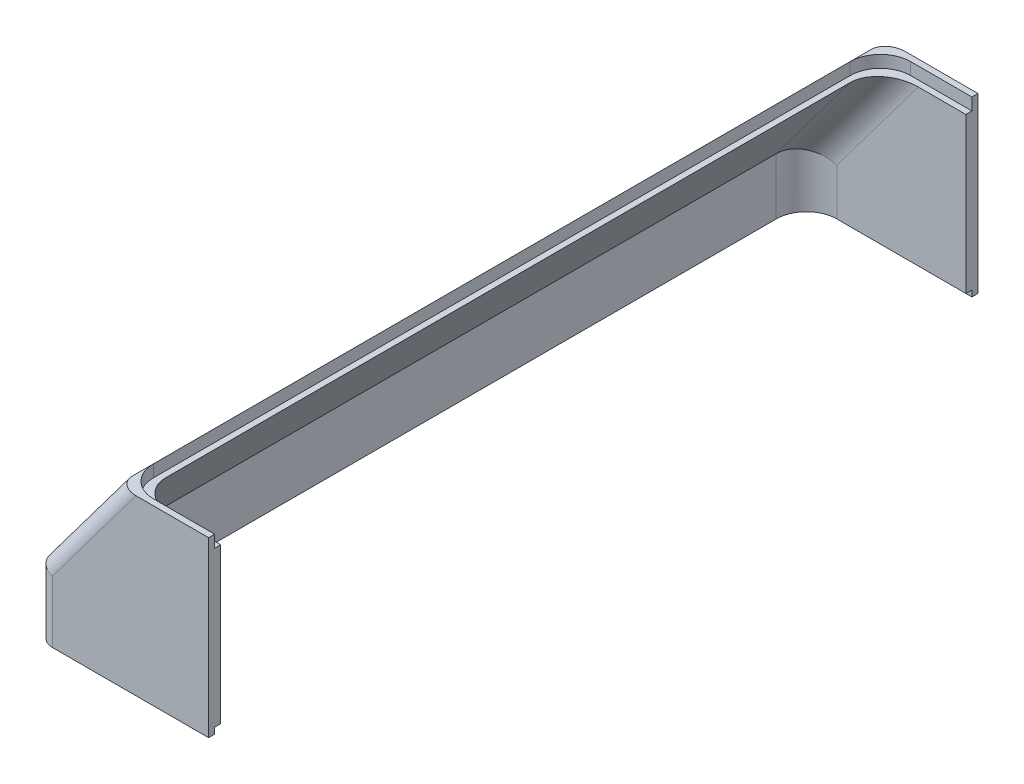
from build123d import *

# Parameters (mm, degrees)
SALIENTE_EXTRUIR1_DEPTH = 123
SALIENTE_EXTRUIR2_DEPTH = 4
CROQUIS3_W              = 2
CROQUIS3_H              = 4
CORTAR_EXTRUIR1_DEPTH   = 30.221833509
CROQUIS3_3_W            = 2
CROQUIS3_3_H            = 2
CORTAR_EXTRUIR2_DEPTH   = 54.613071269
REDONDEO2_R             = 10
REDONDEO3_R             = 5


# Read off the part's stored shape, not the designer's step: Simetría1
with BuildPart() as part:
    # Croquis1 → Saliente-Extruir1 (new, symmetric)
    with BuildSketch(Plane.XY):
        Polygon((-30.055424469, 20), (-30.055424469, 0), (-30.055424469, -2), (-28.055424469, -2), (-28.055424469, 0), (-26.055424469, 0), (-26.055424469, 18.666666667), (-1.66418671, 51.188317013), (-3.66418671, 51.188317013), (-3.66418671, 55.188317013), align=None)
    extrude(amount=SALIENTE_EXTRUIR1_DEPTH, both=True)

    # Croquis2 → Saliente-Extruir2 (add)
    with BuildSketch(Plane.XY.offset(123)):
        Polygon((26.5576468, 13.444650029), (26.5576468, 18.666666667), (26.5576468, 55.188317013), (-3.66418671, 55.188317013), (-30.055424469, 20), (-30.055424469, 14.33808094), (-30.055424469, -2), (26.5576468, -2), align=None)
    extrude(amount=SALIENTE_EXTRUIR2_DEPTH)

    # Croquis3 → Cortar-Extruir1 (cut)
    with BuildSketch(Plane(origin=(26.5576468, 0, 0), x_dir=(0, 0, -1), z_dir=(1, 0, 0))):
        with Locations((-124, 53.188317013)):
            Rectangle(CROQUIS3_W, CROQUIS3_H)
    extrude(amount=-CORTAR_EXTRUIR1_DEPTH, mode=Mode.SUBTRACT)

    # Croquis3<3> → Cortar-Extruir2 (cut)
    with BuildSketch(Plane(origin=(26.5576468, 0, 0), x_dir=(0, 0, -1), z_dir=(1, 0, 0))):
        with Locations((-124, -1)):
            Rectangle(CROQUIS3_3_W, CROQUIS3_3_H)
    extrude(amount=-CORTAR_EXTRUIR2_DEPTH, mode=Mode.SUBTRACT)

    # Redondeo2
    redondeo2_edges = [part.edges().sort_by_distance(p)[0] for p in [
        (-26.055424469, 9.333333333, 123),
        (-3.664186709, 53.188317013, 125),
        (-28.055424469, -1, 125),
        (-13.85980559, 34.92749184, 123),
    ]]
    fillet(redondeo2_edges, radius=REDONDEO2_R)

    # Redondeo3
    redondeo3_edges = [part.edges().sort_by_distance(p)[0] for p in [
        (-16.85980559, 37.594158506, 127),
        (-30.055424469, 9, 127),
    ]]
    fillet(redondeo3_edges, radius=REDONDEO3_R)

    # Simetría1
    split(bisect_by=Plane(origin=(0, 0, 0), x_dir=(1, 0, 0), z_dir=(0, 0, -1)), keep=Keep.BOTTOM)

    # Simetr_a1 2: part across plane


with BuildPart() as part_1:
    add(part.part)
    add(part.part.mirror(Plane(origin=(0, 0, 0), x_dir=(1, 0, 0), z_dir=(0, 0, -1))))


solid = part_1.part
